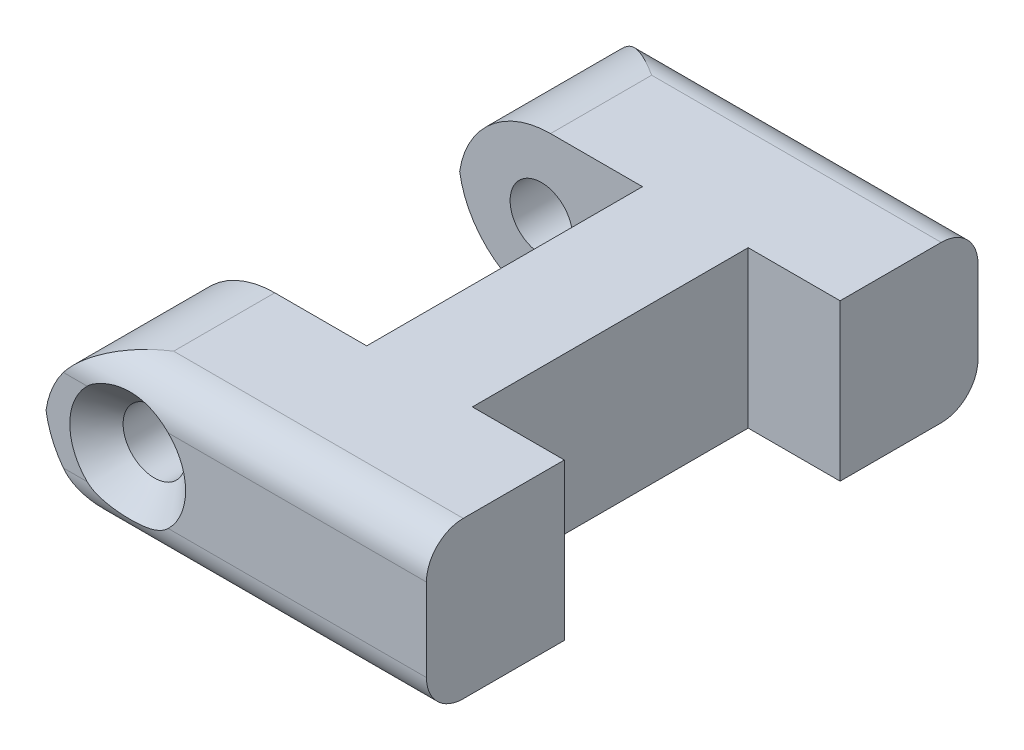
from build123d import *

# Parameters (mm, degrees)
BOSS_EXTRUDE1_DEPTH                                 = 8.5
CUT_EXTRUDE1_REACH                                  = 35.245
SKETCH2_R                                           = 1.5
FILLET1_R                                           = 5
FILLET2_R                                           = 2
CSK_FOR_M3_COUNTERSUNK_FLAT_HEAD_SCREW1_D           = 3.4
CSK_FOR_M3_COUNTERSUNK_FLAT_HEAD_SCREW1_CSINK_D     = 6.3
CSK_FOR_M3_COUNTERSUNK_FLAT_HEAD_SCREW1_CSINK_ANGLE = 90
CUT_EXTRUDE2_DEPTH                                  = 3


with BuildPart() as part:
    # Sketch1 → Boss-Extrude1 (new body)
    with BuildSketch(Plane(origin=(0, 0, 0), x_dir=(1, 0, 0), z_dir=(0, 1, 0))):
        Polygon((-11.531971071, 19.053328449), (9.218028929, 19.053328449), (9.218028929, 11.553328449), (4.218028929, 11.553328449), (4.218028929, -3.446671551), (9.218028929, -3.446671551), (9.218028929, -10.946671551), (-11.531971071, -10.946671551), (-11.531971071, -3.446671551), (-1.531971071, -3.446671551), (-1.531971071, 11.553328449), (-11.531971071, 11.553328449), align=None)
    extrude(amount=BOSS_EXTRUDE1_DEPTH)

    # Cut-Extrude1: up to this face of the body (flat: up to its plane)
    cut_extrude1_end = Plane(part.part.faces().sort_by_distance((-1.156971071, 4.25, -19.053328449))[0])
    # Sketch2 → Cut-Extrude1 (cut, up to the picked face)
    with BuildSketch(Plane.XY.offset(10.946671551), mode=Mode.PRIVATE) as cut_extrude1_sk1:
        with Locations((-7.031971071, 4.25)):
            Circle(SKETCH2_R)
    cut_extrude1_tool1 = split(extrude(cut_extrude1_sk1.sketch, amount=-CUT_EXTRUDE1_REACH, mode=Mode.PRIVATE), bisect_by=cut_extrude1_end, keep=Keep.BOTH, mode=Mode.PRIVATE)
    add(cut_extrude1_tool1.solids().sort_by(Axis((-7.031971, 4.25, 10.946672), (0, 0, -1)))[0], mode=Mode.SUBTRACT)

    # Fillet1
    # the kernel refuses this fillet: 5 mm, written as the material it takes off along each edge
    with BuildSketch(Plane(origin=(-11.531971071, 0, 0.946671551), x_dir=(0, 1, 0), z_dir=(0, 0, -1)), Plane(origin=(-11.531971071, 8.5, 23.446671551), x_dir=(1, 0, 0), z_dir=(0, 0, -1))) as fillet1_piece_1:
        with BuildLine():
            CenterArc((FILLET1_R, FILLET1_R), FILLET1_R, 180, 90)
            Line((0, FILLET1_R), (0, 0))
            Line((0, 0), (FILLET1_R, 0))
        make_face()
    extrude(amount=32.5, mode=Mode.SUBTRACT)
    with BuildSketch(Plane(origin=(-11.531971071, 8.5, 0.946671551), x_dir=(0, -1, 0), z_dir=(0, 0, -1)), Plane(origin=(-11.531971071, 0, 23.446671551), x_dir=(1, 0, 0), z_dir=(0, 0, -1))) as fillet1_piece_2:
        with BuildLine():
            CenterArc((FILLET1_R, -FILLET1_R), FILLET1_R, 90, 90)
            Line((0, -FILLET1_R), (0, 0))
            Line((0, 0), (FILLET1_R, 0))
        make_face()
    extrude(amount=32.5, mode=Mode.SUBTRACT)

    # Fillet2
    # the kernel refuses this fillet: 2 mm, written as the material it takes off along each edge
    with BuildSketch(Plane(origin=(-11.531971071, 0, -19.053328449), x_dir=(0, 1, 0), z_dir=(1, 0, 0)), Plane(origin=(14.218028929, 8.5, 10.946671551), x_dir=(0, 0, -1), z_dir=(-1, 0, 0))) as fillet2_piece_1:
        with BuildLine():
            CenterArc((FILLET2_R, FILLET2_R), FILLET2_R, 180, 90)
            Line((0, FILLET2_R), (0, 0))
            Line((0, 0), (FILLET2_R, 0))
        make_face()
    extrude(amount=25.75, mode=Mode.SUBTRACT)
    with BuildSketch(Plane(origin=(-11.531971071, 8.5, -19.053328449), x_dir=(0, -1, 0), z_dir=(1, 0, 0)), Plane(origin=(14.218028929, 0, 10.946671551), x_dir=(0, 0, -1), z_dir=(-1, 0, 0))) as fillet2_piece_2:
        with BuildLine():
            CenterArc((FILLET2_R, -FILLET2_R), FILLET2_R, 90, 90)
            Line((0, -FILLET2_R), (0, 0))
            Line((0, 0), (FILLET2_R, 0))
        make_face()
    extrude(amount=25.75, mode=Mode.SUBTRACT)

    # CSK for M3 Countersunk Flat Head Screw1 (through all)
    with Locations(Plane.XY.offset(10.946671551)):
        with Locations((-7.031971071, 4.25)):
            CounterSinkHole(CSK_FOR_M3_COUNTERSUNK_FLAT_HEAD_SCREW1_D / 2, CSK_FOR_M3_COUNTERSUNK_FLAT_HEAD_SCREW1_CSINK_D / 2, counter_sink_angle=CSK_FOR_M3_COUNTERSUNK_FLAT_HEAD_SCREW1_CSINK_ANGLE)

    # Sketch5 → Cut-Extrude2 (cut)
    with BuildSketch(Plane(origin=(0, 0, -19.053328449), x_dir=(-1, 0, 0), z_dir=(0, 0, -1))):
        Polygon((7.031971071, 7.425426481), (4.281971071, 5.83771324), (4.281971071, 2.66228676), (7.031971071, 1.074573519), (9.781971071, 2.66228676), (9.781971071, 5.83771324), align=None)
    extrude(amount=-CUT_EXTRUDE2_DEPTH, mode=Mode.SUBTRACT)


solid = part.part
